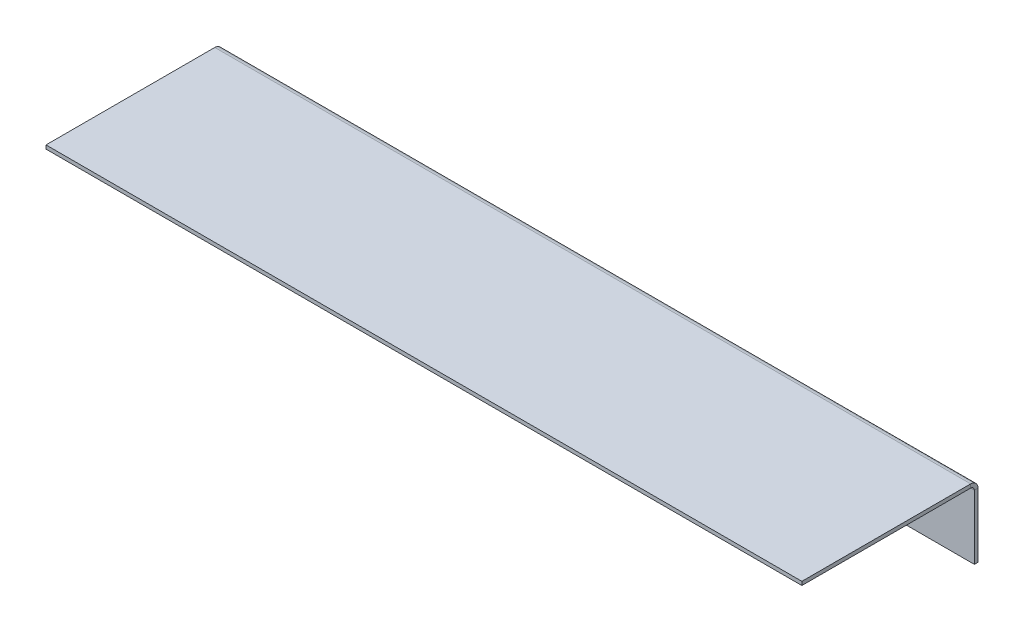
from build123d import *

# Parameters (mm, degrees)
BASE_FLANGE1_DEPTH = 654.05
SKETCH10_W         = 152.4
SKETCH10_H         = 61.9125
CUT_EXTRUDE5_DEPTH = 683.89076222


# Sheet-metal steps are written as plain solids
with BuildPart() as part:
    # Sketch1 → Base-Flange1 (new body)
    with BuildSketch(Plane(origin=(0, 0, 0), x_dir=(0, 0, -1), z_dir=(1, 0, 0))):
        with BuildLine():
            Line((0, 0), (146.05, 0))
            ThreePointArc((146.05, 0), (150.540128061, 1.859871939), (152.4, 6.35))
            Line((152.4, 6.35), (152.4, 117.475))
            ThreePointArc((152.4, 117.475), (150.540128061, 121.965128061), (146.05, 123.825))
            Line((146.05, 123.825), (0, 123.825))
            Line((0, 123.825), (0, 120.65))
            Line((0, 120.65), (146.05, 120.65))
            ThreePointArc((146.05, 120.65), (148.29506403, 119.72006403), (149.225, 117.475))
            Line((149.225, 117.475), (149.225, 6.35))
            ThreePointArc((149.225, 6.35), (148.29506403, 4.10493597), (146.05, 3.175))
            Line((146.05, 3.175), (0, 3.175))
            Line((0, 3.175), (0, 0))
        make_face()
    extrude(amount=BASE_FLANGE1_DEPTH)

    # Sketch10 → Cut-Extrude5 (cut, through all)
    with BuildSketch(Plane(origin=(654.05, 0, 0), x_dir=(0, 0, -1), z_dir=(1, 0, 0))):
        with Locations((76.2, 30.95625)):
            Rectangle(SKETCH10_W, SKETCH10_H)
    extrude(amount=-CUT_EXTRUDE5_DEPTH, mode=Mode.SUBTRACT)


solid = part.part
